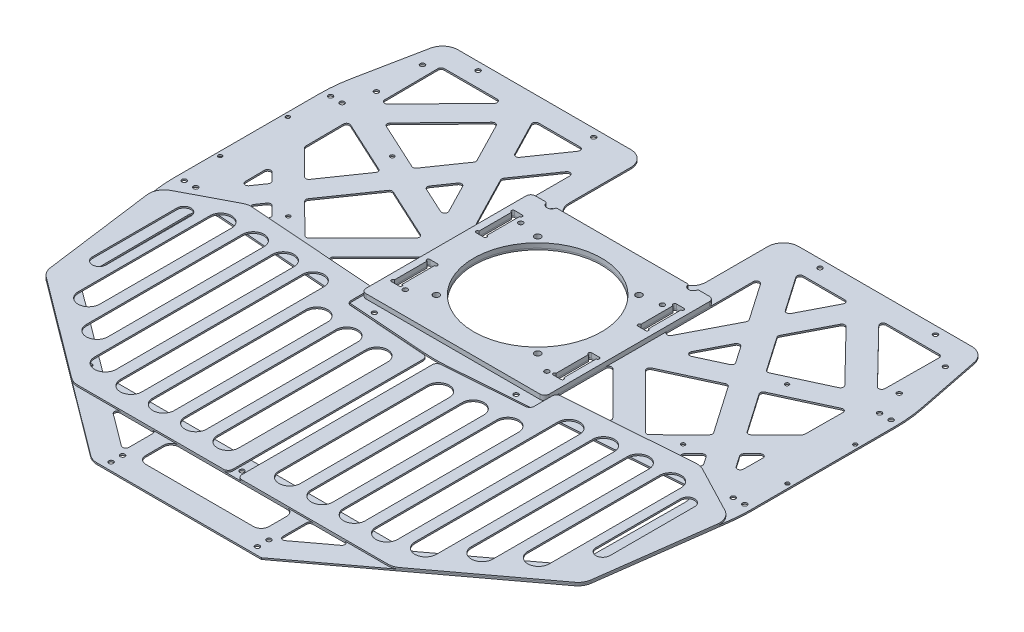
from build123d import *

# Parameters (mm, degrees)
SKETCH_1_W           = 119
SKETCH_1_H           = 110
SKETCH_1_R           = 41.5
SKETCH_1_R_2         = 2
SKETCH_1_W_2         = 5
SKETCH_1_H_2         = 25
EXTRUDE_1_DEPTH      = 3
SKETCH_16_R          = 1.5
SKETCH_16_R_2        = 41.5
SKETCH_16_R_3        = 2
SKETCH_16_R_4        = 1.25
SKETCH_16_W          = 5
SKETCH_16_H          = 25
SKETCH_16_W_2        = 80
SKETCH_16_H_2        = 21.5
EXTRUDE_2_DEPTH      = 1
FILLET_1_R           = 3
CUT_EXTRUDE_9_DEPTH  = 300.947078666
EXTRUDE_START        = -1
EXTRUDE_3_DEPTH      = 1
SKETCH_19_R          = 1.25
SKETCH_19_R_2        = 1.5
CUT_EXTRUDE_10_DEPTH = 300.947078666
FILLET_4_R           = 100
FILLET_5_R           = 10
FILLET_10_R          = 5
SKETCH_3_R           = 1
SKETCH_3_R_2         = 1.5
CUT_EXTRUDE_2_DEPTH  = 300.958747164
FILLET_6_R           = 2
MOVE_FACE_1_BY       = 1.5
MOVE_FACE_1_2_BY     = 1.5
FILLET_7_R           = 1
EXTRUDE_3_2_DEPTH    = 1
CUT_EXTRUDE_11_DEPTH = 300.938743746
FILLET_8_R           = 3
FILLET_9_R           = 10


# Read off the part's stored shape, not the designer's step: 拉伸-薄壁3
with BuildPart() as part:
    # 草图1 → 凸台-拉伸1 (new body)
    with BuildSketch(Plane(origin=(0, 0, 0), x_dir=(1, 0, 0), z_dir=(0, 1, 0))):
        Rectangle(SKETCH_1_W, SKETCH_1_H)
        with Locations(Location((0, 0, 0), (0, 0, 270))):
            Circle(SKETCH_1_R, mode=Mode.SUBTRACT)
        with Locations(Location((-32.880465325, 32.880465325, 0), (0, 0, 270))):
            Circle(SKETCH_1_R_2, mode=Mode.SUBTRACT)
        with Locations(Location((32.880465325, 32.880465325, 0), (0, 0, 90))):
            Circle(SKETCH_1_R_2, mode=Mode.SUBTRACT)
        with Locations(Location((32.880465325, -32.880465325, 0), (0, 0, 270))):
            Circle(SKETCH_1_R_2, mode=Mode.SUBTRACT)
        with Locations(Location((-32.880465325, -32.880465325, 0), (0, 0, 90))):
            Circle(SKETCH_1_R_2, mode=Mode.SUBTRACT)
        with Locations((52.5, -27.5)):
            Rectangle(SKETCH_1_W_2, SKETCH_1_H_2, mode=Mode.SUBTRACT)
        with Locations((52.5, 27.5)):
            Rectangle(SKETCH_1_W_2, SKETCH_1_H_2, mode=Mode.SUBTRACT)
        with Locations((-52.5, -27.5)):
            Rectangle(SKETCH_1_W_2, SKETCH_1_H_2, mode=Mode.SUBTRACT)
        with Locations((-52.5, 27.5)):
            Rectangle(SKETCH_1_W_2, SKETCH_1_H_2, mode=Mode.SUBTRACT)
    extrude(amount=EXTRUDE_1_DEPTH)

    # 圆角1
    fillet_1_edges = [part.edges().sort_by_distance(p)[0] for p in [
        (59.5, 1.5, 55),
        (-59.5, 1.5, 55),
        (-59.5, 1.5, -55),
        (59.5, 1.5, -55),
    ]]
    fillet(fillet_1_edges, radius=FILLET_1_R)


with BuildPart() as body_2:
    # 草图16 → 凸台-拉伸2 (new body)
    with BuildSketch(Plane(origin=(0, 0, 0), x_dir=(1, 0, 0), z_dir=(0, 1, 0))):
        Polygon((55, -234.5), (175, -145), (187, -55), (187, 55), (175, 115), (44.5, 115), (44.5, 55), (-44.5, 55), (-44.5, 115), (-175, 115), (-187, 55), (-187, -55), (-175, -145), (-55, -234.5), align=None)
        with Locations(Location((47.5, -229.5, 0), (0, 0, 90))):
            Circle(SKETCH_16_R, mode=Mode.SUBTRACT)
        with Locations(Location((0, 0, 0), (0, 0, 270))):
            Circle(SKETCH_16_R_2, mode=Mode.SUBTRACT)
        with Locations(Location((-32.880465325, 32.880465325, 0), (0, 0, 270))):
            Circle(SKETCH_16_R_3, mode=Mode.SUBTRACT)
        with Locations(Location((32.880465325, 32.880465325, 0), (0, 0, 270))):
            Circle(SKETCH_16_R_3, mode=Mode.SUBTRACT)
        with Locations(Location((32.880465325, -32.880465325, 0), (0, 0, 270))):
            Circle(SKETCH_16_R_3, mode=Mode.SUBTRACT)
        with Locations(Location((-32.880465325, -32.880465325, 0), (0, 0, 270))):
            Circle(SKETCH_16_R_3, mode=Mode.SUBTRACT)
        with Locations(Location((47.5, -222, 0), (0, 0, 90))):
            Circle(SKETCH_16_R, mode=Mode.SUBTRACT)
        with Locations(Location((-174.5, 47.5, 0), (0, 0, 270))):
            Circle(SKETCH_16_R, mode=Mode.SUBTRACT)
        with Locations(Location((-182, 47.5, 0), (0, 0, 270))):
            Circle(SKETCH_16_R, mode=Mode.SUBTRACT)
        with Locations(Location((-47.5, -222, 0), (0, 0, 270))):
            Circle(SKETCH_16_R, mode=Mode.SUBTRACT)
        with Locations(Location((-47.5, -229.5, 0), (0, 0, 270))):
            Circle(SKETCH_16_R, mode=Mode.SUBTRACT)
        with Locations(Location((-182, -47.5, 0), (0, 0, 90))):
            Circle(SKETCH_16_R, mode=Mode.SUBTRACT)
        with Locations(Location((-174.5, -47.5, 0), (0, 0, 90))):
            Circle(SKETCH_16_R, mode=Mode.SUBTRACT)
        with Locations(Location((174.5, -47.5, 0), (0, 0, 270))):
            Circle(SKETCH_16_R, mode=Mode.SUBTRACT)
        with Locations(Location((182, -47.5, 0), (0, 0, 270))):
            Circle(SKETCH_16_R, mode=Mode.SUBTRACT)
        with Locations(Location((182, 47.5, 0), (0, 0, 90))):
            Circle(SKETCH_16_R, mode=Mode.SUBTRACT)
        with Locations(Location((174.5, 47.5, 0), (0, 0, 90))):
            Circle(SKETCH_16_R, mode=Mode.SUBTRACT)
        with Locations(Location((-128.2, -33.75, 0), (0, 0, 270))):
            Circle(SKETCH_16_R_4, mode=Mode.SUBTRACT)
        with Locations(Location((-184.2, -22, 0), (0, 0, 270))):
            Circle(SKETCH_16_R_4, mode=Mode.SUBTRACT)
        with Locations(Location((-184.2, 22, 0), (0, 0, 270))):
            Circle(SKETCH_16_R_4, mode=Mode.SUBTRACT)
        with Locations(Location((-128.2, 33.75, 0), (0, 0, 270))):
            Circle(SKETCH_16_R_4, mode=Mode.SUBTRACT)
        with Locations(Location((184.2, -22, 0), (0, 0, 90))):
            Circle(SKETCH_16_R_4, mode=Mode.SUBTRACT)
        with Locations(Location((184.2, 22, 0), (0, 0, 90))):
            Circle(SKETCH_16_R_4, mode=Mode.SUBTRACT)
        with Locations((-52.5, -27.5)):
            Rectangle(SKETCH_16_W, SKETCH_16_H, mode=Mode.SUBTRACT)
        with Locations((-52.5, 27.5)):
            Rectangle(SKETCH_16_W, SKETCH_16_H, mode=Mode.SUBTRACT)
        with Locations((0, -208.75)):
            Rectangle(SKETCH_16_W_2, SKETCH_16_H_2, mode=Mode.SUBTRACT)
        with Locations((52.5, 27.5)):
            Rectangle(SKETCH_16_W, SKETCH_16_H, mode=Mode.SUBTRACT)
        with Locations((52.5, -27.5)):
            Rectangle(SKETCH_16_W, SKETCH_16_H, mode=Mode.SUBTRACT)
    extrude(amount=-EXTRUDE_2_DEPTH)

    # 草图17 → 切除-拉伸9 (cut, through all)
    with BuildSketch(Plane(origin=(0, 0, 0), x_dir=(1, 0, 0), z_dir=(0, 1, 0))):
        Polygon((-98.96080429, -183), (98.96080429, -183), (160.966732462, -136.753911905), (162.702941459, 100), (59.5, 100), (59.5, -55), (-59.5, -55), (-59.5, 100), (-162.702941459, 100), (-160.966732462, -136.753911905), align=None)
        Polygon((-78.849072447, -198), (-50.022256804, -198), (-50.022256804, -219.5), align=None)
        Polygon((50.022256804, -219.5), (78.849072447, -198), (50.022256804, -198), align=None)
    extrude(amount=-CUT_EXTRUDE_9_DEPTH, mode=Mode.SUBTRACT)

    # Extrude 3 outline → Extrude 3 (add)
    # profile 1 of 3: a face of its own
    with BuildSketch(Plane(origin=(0, 0, 0), x_dir=(1, 0, 0), z_dir=(0, 1, 0)).offset(EXTRUDE_START)):
        Polygon((-123.2017187, 21.167349767), (-143.365468852, -7.95638964), (-162.0478365, 10.668207518), (-161.891368227, -10.668207518), (-152.041460952, -20.487656449), (-161.716875739, -34.462450661), (-161.566088013, -55.024251739), (-113.885083764, -58.526044704), (-110.542602307, -61.858190384), (-107.677017531, -58.98197811), (0, -66.890004134), (107.677017531, -58.98197811), (110.542602307, -61.858190384), (113.885083764, -58.526044704), (161.566088013, -55.024251739), (161.716875739, -34.462450661), (152.041460952, -20.487656449), (161.891368227, -10.668207518), (162.0478365, 10.668207518), (143.365468852, -7.95638964), (123.2017187, 21.167349767), (162.257146386, 39.210240369), (162.396113813, 58.16019519), (121.579218349, 100), (102.661817077, 100), (88.125628644, 71.829895102), (68.622125025, 100), (59.5, 100), (59.5, 86.824356082), (80.334669309, 56.731567041), (59.5, 16.355451759), (59.5, -10.626288093), (93.713885197, -44.967061176), (59.5, -47.47980067), (59.5, -55), (-59.5, -55), (-59.5, -47.47980067), (-93.713885197, -44.967061176), (-59.5, -10.626288093), (-59.5, 16.355451759), (-80.334669309, 56.731567041), (-59.5, 86.824356082), (-59.5, 100), (-68.622125025, 100), (-88.125628644, 71.829895102), (-102.661817077, 100), (-121.579218349, 100), (-162.396113813, 58.16019519), (-162.257146385, 39.210240369), align=None)
        Polygon((-141.247366657, -31.248372741), (-130.171990124, -42.289501478), (-147.985874554, -40.98121244), align=None, mode=Mode.SUBTRACT)
        Polygon((-72.386735219, -2.308239728), (-110.578663986, -40.641809616), (-132.571374557, -18.717105932), (-109.378765899, 14.781399338), align=None, mode=Mode.SUBTRACT)
        Polygon((147.985874554, -40.98121244), (130.171990124, -42.289501478), (141.247366657, -31.248372741), align=None, mode=Mode.SUBTRACT)
        Polygon((72.386735219, -2.308239728), (109.378765899, 14.781399338), (132.571374557, -18.717105932), (110.578663986, -40.641809616), align=None, mode=Mode.SUBTRACT)
        Polygon((-76.178861954, 15.967002849), (-100.71120158, 27.300493386), (-90.00589755, 42.762819714), align=None, mode=Mode.SUBTRACT)
        Polygon((-97.796856885, 57.861147775), (-114.534154381, 33.686443815), (-149.539552057, 49.858294903), (-112.996557005, 87.317091384), align=None, mode=Mode.SUBTRACT)
        Polygon((76.178861954, 15.967002849), (90.00589755, 42.762819714), (100.71120158, 27.300493386), align=None, mode=Mode.SUBTRACT)
        Polygon((114.534154381, 33.686443815), (97.796856885, 57.861147775), (112.996557005, 87.317091384), (149.539552057, 49.858294903), align=None, mode=Mode.SUBTRACT)
    # profile 2 of 3: a face of its own
    with BuildSketch(Plane(origin=(0, 0, 0), x_dir=(1, 0, 0), z_dir=(0, 1, 0)).offset(EXTRUDE_START)):
        with BuildLine():
            Line((-173.0173018, 47.272830358), (-174.236207596, 46.023377649))
            ThreePointArc((-174.236207596, 46.023377649), (-173.426295955, 46.452546123), (-173.0173018, 47.272830358))
        make_face()
    # profile 3 of 3: a face of its own
    with BuildSketch(Plane(origin=(0, 0, 0), x_dir=(1, 0, 0), z_dir=(0, 1, 0)).offset(EXTRUDE_START)):
        with BuildLine():
            ThreePointArc((173.0173018, 47.272830358), (173.426295955, 46.452546123), (174.236207596, 46.023377649))
            Line((174.236207596, 46.023377649), (173.0173018, 47.272830358))
        make_face()
    extrude(amount=EXTRUDE_3_DEPTH)

    # 草图19 → 切除-拉伸10 (cut, through all)
    with BuildSketch(Plane(origin=(0, 0, 0), x_dir=(1, 0, 0), z_dir=(0, 1, 0))):
        with Locations(Location((-128.2, -33.75, 0), (0, 0, 270))):
            Circle(SKETCH_19_R)
        with Locations(Location((-128.2, 33.75, 0), (0, 0, 270))):
            Circle(SKETCH_19_R)
        with Locations(Location((128.2, 33.75, 0), (0, 0, 90))):
            Circle(SKETCH_19_R)
        with Locations(Location((128.2, -33.75, 0), (0, 0, 90))):
            Circle(SKETCH_19_R)
        with Locations(Location((-174.5, 47.5, 0), (0, 0, 270))):
            Circle(SKETCH_19_R_2)
        with Locations(Location((174.5, 47.5, 0), (0, 0, 90))):
            Circle(SKETCH_19_R_2)
        Polygon((-107.677017531, -58.98197811), (-110.542602307, -61.858190384), (-113.885083764, -58.526044704), align=None)
        Polygon((113.885083764, -58.526044704), (107.677017531, -58.98197811), (110.542602307, -61.858190384), align=None)
    extrude(amount=-CUT_EXTRUDE_10_DEPTH, mode=Mode.SUBTRACT)

    # 圆角4
    fillet_4_edges = [body_2.edges().sort_by_distance(p)[0] for p in [
        (187, -0.5, -55),
        (187, -0.5, 55),
        (-187, -0.5, 55),
        (-187, -0.5, -55),
        (0, -0.5, 66.890004134),
    ]]
    fillet(fillet_4_edges, radius=FILLET_4_R)

    # 圆角5
    fillet_5_edges = [body_2.edges().sort_by_distance(p)[0] for p in [
        (160.966732462, -0.5, 136.753911905),
        (98.96080429, -0.5, 183),
        (-98.96080429, -0.5, 183),
        (-160.966732462, -0.5, 136.753911905),
        (44.5, -0.5, -55),
        (44.5, -0.5, -115),
        (175, -0.5, -115),
        (175, -0.5, 145),
        (-55, -0.5, 234.5),
        (-175, -0.5, 145),
        (-175, -0.5, -115),
        (-44.5, -0.5, -115),
        (-44.5, -0.5, -55),
        (-161.566088013, -0.5, 55.024251739),
        (161.566088013, -0.5, 55.024251739),
    ]]
    fillet(fillet_5_edges, radius=FILLET_5_R)

    # 圆角10
    fillet_10_edges = [body_2.edges().sort_by_distance(p)[0] for p in [
        (-40, -0.5, 219.5),
        (-40, -0.5, 198),
        (40, -0.5, 198),
        (40, -0.5, 219.5),
    ]]
    fillet(fillet_10_edges, radius=FILLET_10_R)


with BuildPart() as cut_extrude_2_tool:
    # 草图3 → 切除-拉伸2 (new, through all)
    with BuildSketch(Plane(origin=(0, 3, 0), x_dir=(1, 0, 0), z_dir=(0, 1, 0))):
        with Locations((-55, 39)):
            Circle(SKETCH_3_R)
        with Locations((-55, 16)):
            Circle(SKETCH_3_R)
        with Locations((-50, 16)):
            Circle(SKETCH_3_R)
        with Locations((-50, 39)):
            Circle(SKETCH_3_R)
        with Locations((-50, -39)):
            Circle(SKETCH_3_R)
        with Locations((-50, -16)):
            Circle(SKETCH_3_R)
        with Locations((-55, -16)):
            Circle(SKETCH_3_R)
        with Locations((-55, -39)):
            Circle(SKETCH_3_R)
        with Locations((55, -39)):
            Circle(SKETCH_3_R)
        with Locations((50, -39)):
            Circle(SKETCH_3_R)
        with Locations((55, -16)):
            Circle(SKETCH_3_R)
        with Locations((50, -16)):
            Circle(SKETCH_3_R)
        with Locations((50, 39)):
            Circle(SKETCH_3_R)
        with Locations((50, 16)):
            Circle(SKETCH_3_R)
        with Locations((55, 16)):
            Circle(SKETCH_3_R)
        with Locations((55, 39)):
            Circle(SKETCH_3_R)
        with Locations(Location((-46, -60, 0), (0, 0, 270))):
            Circle(SKETCH_3_R_2)
        with Locations(Location((-46, -40, 0), (0, 0, 270))):
            Circle(SKETCH_3_R_2)
        with Locations(Location((46, -60, 0), (0, 0, 90))):
            Circle(SKETCH_3_R_2)
        with Locations(Location((46, -40, 0), (0, 0, 90))):
            Circle(SKETCH_3_R_2)
        with Locations(Location((-108.918385836, -181.996911832, 0), (0, 0, 270))):
            Circle(SKETCH_3_R_2)
        with Locations(Location((-154.610734625, -151.383038143, 0), (0, 0, 270))):
            Circle(SKETCH_3_R_2)
        with Locations(Location((-169.793690199, -110, 0), (0, 0, 270))):
            Circle(SKETCH_3_R_2)
        with Locations(Location((-169.793690199, -65, 0), (0, 0, 270))):
            Circle(SKETCH_3_R_2)
        with Locations(Location((-169.793690199, 65, 0), (0, 0, 270))):
            Circle(SKETCH_3_R_2)
        with Locations(Location((-169.793690199, 95, 0), (0, 0, 270))):
            Circle(SKETCH_3_R_2)
        with Locations(Location((-148.5, 109.837741687, 0), (0, 0, 270))):
            Circle(SKETCH_3_R_2)
        with Locations(Location((-73.5, 109.837741687, 0), (0, 0, 270))):
            Circle(SKETCH_3_R_2)
        with Locations(Location((0, -192, 0), (0, 0, 270))):
            Circle(SKETCH_3_R_2)
        with Locations(Location((73.5, 109.837741687, 0), (0, 0, 90))):
            Circle(SKETCH_3_R_2)
        with Locations(Location((148.5, 109.837741687, 0), (0, 0, 90))):
            Circle(SKETCH_3_R_2)
        with Locations(Location((169.793690199, 95, 0), (0, 0, 90))):
            Circle(SKETCH_3_R_2)
        with Locations(Location((169.793690199, 65, 0), (0, 0, 90))):
            Circle(SKETCH_3_R_2)
        with Locations(Location((169.793690199, -65, 0), (0, 0, 90))):
            Circle(SKETCH_3_R_2)
        with Locations(Location((169.793690199, -110, 0), (0, 0, 90))):
            Circle(SKETCH_3_R_2)
        with Locations(Location((154.610734625, -151.383038143, 0), (0, 0, 90))):
            Circle(SKETCH_3_R_2)
        with Locations(Location((108.918385836, -181.996911832, 0), (0, 0, 90))):
            Circle(SKETCH_3_R_2)
        with Locations(Location((-46, 55, 0), (0, 0, 270))):
            Circle(SKETCH_3_R_2)
        with Locations(Location((-46, 35, 0), (0, 0, 270))):
            Circle(SKETCH_3_R_2)
        with Locations(Location((46, 35, 0), (0, 0, 90))):
            Circle(SKETCH_3_R_2)
        with Locations(Location((46, 55, 0), (0, 0, 90))):
            Circle(SKETCH_3_R_2)
    extrude(amount=-CUT_EXTRUDE_2_DEPTH)


with BuildPart() as part_1:
    add(part.part)

    # 切除-拉伸2: cut by cut_extrude_2_tool
    add(cut_extrude_2_tool.part, mode=Mode.SUBTRACT)

    # Move Face 1: a curved face moved inward by 1.5
    add(Solid.thicken(part_1.faces().sort_by_distance((46, 1.5, -53.5))[0], -MOVE_FACE_1_BY), mode=Mode.SUBTRACT)

    # Move Face 1 2: a curved face moved inward by 1.5
    add(Solid.thicken(part_1.faces().sort_by_distance((-46, 1.5, -53.5))[0], -MOVE_FACE_1_2_BY), mode=Mode.SUBTRACT)

    # 圆角7
    fillet_7_edges = [part_1.edges().sort_by_distance(p)[0] for p in [
        (43, 1.5, -55),
        (49, 1.5, -55),
        (-49, 1.5, -55),
        (-43, 1.5, -55),
    ]]
    fillet(fillet_7_edges, radius=FILLET_7_R)


with BuildPart() as body_2_1:
    add(body_2.part)

    # 切除-拉伸2: cut by cut_extrude_2_tool
    add(cut_extrude_2_tool.part, mode=Mode.SUBTRACT)

    # 圆角6
    fillet_6_edges = [body_2_1.edges().sort_by_distance(p)[0] for p in [
        (50.022256804, -0.5, 219.5),
        (50.022256804, -0.5, 198),
        (78.849072447, -0.5, 198),
        (162.702941459, -0.5, -100),
        (-162.702941459, -0.5, -100),
        (-50.022256804, -0.5, 219.5),
        (-78.849072447, -0.5, 198),
        (-50.022256804, -0.5, 198),
        (-59.5, -0.5, -86.824356082),
        (-59.5, -0.5, -16.355451759),
        (-59.5, -0.5, 10.626288093),
        (-59.5, -0.5, 47.47980067),
        (-68.622125025, -0.5, -100),
        (-121.579218349, -0.5, -100),
        (-102.661817077, -0.5, -100),
        (-162.257146385, -0.5, -39.210240369),
        (-161.891368227, -0.5, 10.668207518),
        (-162.0478365, -0.5, -10.668207518),
        (-161.716875739, -0.5, 34.462450661),
        (162.0478365, -0.5, -10.668207518),
        (161.891368227, -0.5, 10.668207518),
        (162.396113813, -0.5, -58.16019519),
        (162.257146386, -0.5, -39.210240369),
        (161.716875739, -0.5, 34.462450661),
        (102.661817077, -0.5, -100),
        (68.622125025, -0.5, -100),
        (59.5, -0.5, 10.626288093),
        (59.5, -0.5, -16.355451759),
        (59.5, -0.5, -86.824356082),
        (59.5, -0.5, 47.47980067),
        (80.334669309, -0.5, -56.731567041),
        (93.713885197, -0.5, 44.967061176),
        (88.125628644, -0.5, -71.829895102),
        (152.041460952, -0.5, 20.487656449),
        (123.2017187, -0.5, -21.167349767),
        (121.579218349, -0.5, -100),
        (143.365468852, -0.5, 7.95638964),
        (-152.041460952, -0.5, 20.487656449),
        (-162.396113813, -0.5, -58.16019519),
        (-88.125628644, -0.5, -71.829895102),
        (-93.713885197, -0.5, 44.967061176),
        (-80.334669309, -0.5, -56.731567041),
        (-90.00589755, -0.5, -42.762819714),
        (-100.71120158, -0.5, -27.300493386),
        (-143.365468852, -0.5, 7.95638964),
        (-123.2017187, -0.5, -21.167349767),
        (-130.171990124, -0.5, 42.289501478),
        (-147.985874554, -0.5, 40.98121244),
        (-141.247366657, -0.5, 31.248372741),
        (147.985874554, -0.5, 40.98121244),
        (132.571374557, -0.5, 18.717105932),
        (109.378765899, -0.5, -14.781399338),
        (97.796856885, -0.5, -57.861147775),
        (114.534154381, -0.5, -33.686443815),
        (112.996557005, -0.5, -87.317091384),
        (149.539552057, -0.5, -49.858294903),
        (110.578663986, -0.5, 40.641809616),
        (72.386735219, -0.5, 2.308239728),
        (100.71120158, -0.5, -27.300493386),
        (76.178861954, -0.5, -15.967002849),
        (90.00589755, -0.5, -42.762819714),
        (130.171990124, -0.5, 42.289501478),
        (141.247366657, -0.5, 31.248372741),
        (-76.178861954, -0.5, -15.967002849),
        (-109.378765899, -0.5, -14.781399338),
        (-72.386735219, -0.5, 2.308239728),
        (-110.578663986, -0.5, 40.641809616),
        (-132.571374557, -0.5, 18.717105932),
        (-114.534154381, -0.5, -33.686443815),
        (-149.539552057, -0.5, -49.858294903),
        (-112.996557005, -0.5, -87.317091384),
        (-97.796856885, -0.5, -57.861147775),
    ]]
    fillet(fillet_6_edges, radius=FILLET_6_R)


with BuildPart() as body_3:
    # 草图20 → Extrude 3 2 (new body)
    with BuildSketch(Plane(origin=(0, 0, 0), x_dir=(1, 0, 0), z_dir=(0, 1, 0))):
        Polygon((-3, -198), (-103.938547486, -198), (-175, -145), (-186.122790068, -61.579074488), (-146.87047027, -41.06313007), (-59.5, -47.47980067), (-59.5, -64.525585819), (-3, -68.67506433), align=None)
    extrude(amount=EXTRUDE_3_2_DEPTH)

    # 草图21 → 切除-拉伸11 (cut, through all)
    with BuildSketch(Plane(origin=(0, 1, 0), x_dir=(1, 0, 0), z_dir=(0, 1, 0))):
        with BuildLine():
            Line((-13, -84.472333821), (-13, -181))
            ThreePointArc((-13, -181), (-20, -188), (-27, -181))
            Line((-27, -181), (-27, -84.472333821))
            ThreePointArc((-27, -84.472333821), (-20, -77.472333821), (-13, -84.472333821))
        make_face()
        with BuildLine():
            Line((-34, -82.930049772), (-34, -181))
            ThreePointArc((-34, -181), (-41, -188), (-48, -181))
            Line((-48, -181), (-48, -82.930049772))
            ThreePointArc((-48, -82.930049772), (-41, -75.930049772), (-34, -82.930049772))
        make_face()
        with BuildLine():
            Line((-55, -81.387765724), (-55, -181))
            ThreePointArc((-55, -181), (-62, -188), (-69, -181))
            Line((-69, -181), (-69, -81.387765724))
            ThreePointArc((-69, -81.387765724), (-62, -74.387765724), (-55, -81.387765724))
        make_face()
        with BuildLine():
            Line((-76, -62.799696526), (-76, -181))
            ThreePointArc((-76, -181), (-83, -188), (-90, -181))
            Line((-90, -181), (-90, -62.799696526))
            ThreePointArc((-90, -62.799696526), (-83, -55.799696526), (-76, -62.799696526))
        make_face()
        with BuildLine():
            Line((-97, -61.257412478), (-97, -176.74659096))
            ThreePointArc((-97, -176.74659096), (-104, -183.74659096), (-111, -176.74659096))
            Line((-111, -176.74659096), (-111, -61.257412478))
            ThreePointArc((-111, -61.257412478), (-104, -54.257412478), (-97, -61.257412478))
        make_face()
        with BuildLine():
            Line((-118, -59.71512843), (-118, -161.08409096))
            ThreePointArc((-118, -161.08409096), (-125, -168.08409096), (-132, -161.08409096))
            Line((-132, -161.08409096), (-132, -59.71512843))
            ThreePointArc((-132, -59.71512843), (-125, -52.71512843), (-118, -59.71512843))
        make_face()
        with BuildLine():
            Line((-139, -59.790176559), (-139, -145.42159096))
            ThreePointArc((-139, -145.42159096), (-146, -152.42159096), (-153, -145.42159096))
            Line((-153, -145.42159096), (-153, -59.790176559))
            ThreePointArc((-153, -59.790176559), (-146, -52.790176559), (-139, -59.790176559))
        make_face()
        with BuildLine():
            Line((-159, -66.157625861), (-159, -121.157625861))
            ThreePointArc((-159, -121.157625861), (-163.525219474, -125.682845335), (-168.050438948, -121.157625861))
            Line((-168.050438948, -121.157625861), (-168.050438948, -66.157625861))
            ThreePointArc((-168.050438948, -66.157625861), (-163.525219474, -61.632406388), (-159, -66.157625861))
        make_face()
    extrude(amount=-CUT_EXTRUDE_11_DEPTH, mode=Mode.SUBTRACT)

    # 圆角8
    fillet_8_edges = [body_3.edges().sort_by_distance(p)[0] for p in [
        (-3, 0.5, 198),
        (-59.5, 0.5, 47.47980067),
        (-59.5, 0.5, 64.525585819),
        (-3, 0.5, 68.67506433),
    ]]
    fillet(fillet_8_edges, radius=FILLET_8_R)

    # 圆角9
    fillet_9_edges = [body_3.edges().sort_by_distance(p)[0] for p in [
        (-103.938547486, 0.5, 198),
        (-175, 0.5, 145),
        (-186.122790068, 0.5, 61.579074488),
        (-146.87047027, 0.5, 41.06313007),
    ]]
    fillet(fillet_9_edges, radius=FILLET_9_R)


with BuildPart() as body_4:
    # 镜向1: mirrored copy
    add(body_3.part.mirror(Plane(origin=(0, 0, 0), x_dir=(0, 0, 1), z_dir=(1, 0, 0))))


solid = Compound([part_1.part, body_2_1.part, body_3.part, body_4.part])
